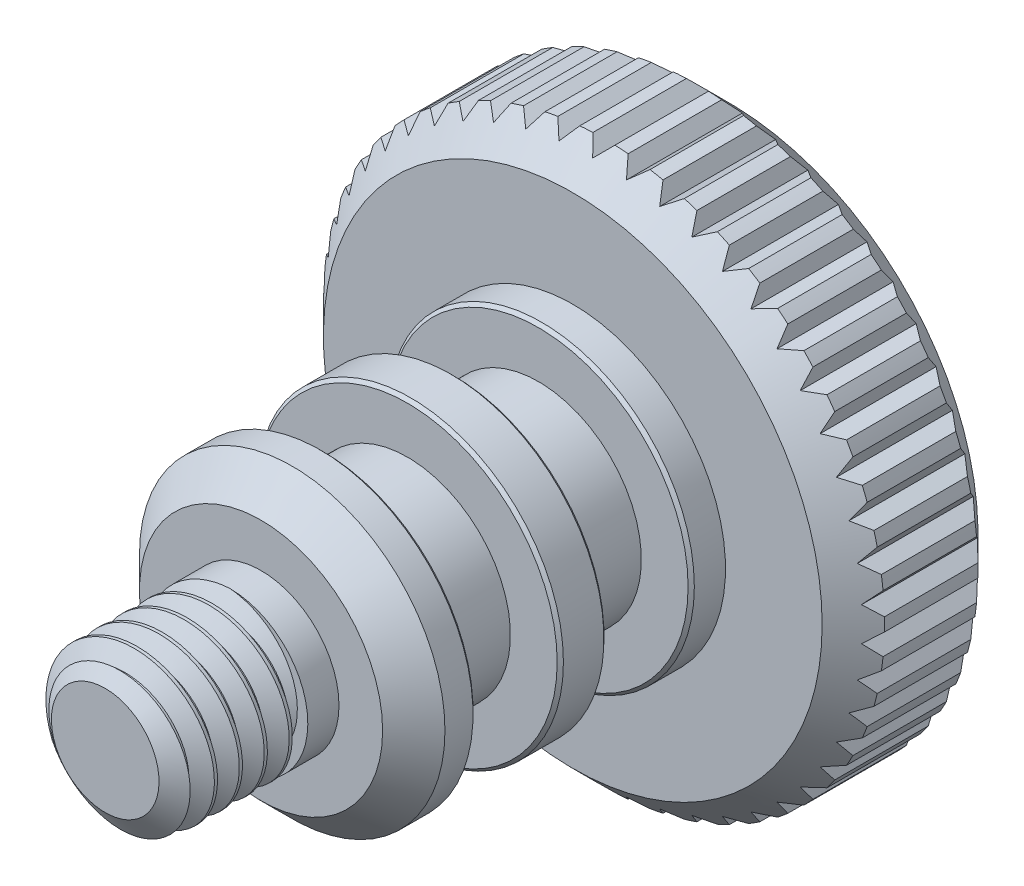
from build123d import *

# Parameters (mm, degrees)
CHAMFER1_SIZE       = 1
CHAMFER2_SIZE       = 0.1
CUT_EXTRUDE1_DEPTH  = 20.672315573
CIRPATTERN1_COUNT   = 50
SKETCH3_R           = 2.5
BOSS_EXTRUDE1_DEPTH = 5
CUT_SWEEP1_PITCH    = 0.8
SKETCH7_R           = 2.5
BOSS_EXTRUDE2_DEPTH = 1


with BuildPart() as part:
    # Sketch1 → Revolve1 (revolve)
    with BuildSketch(Plane(origin=(0, 0, 0), x_dir=(0, 0, -1), z_dir=(1, 0, 0)), mode=Mode.PRIVATE) as revolve1_sk:
        Polygon((0, 0), (0, 4.9), (2, 4.9), (2, 3.3), (4.7, 3.3), (4.7, 4.9), (6.2, 4.9), (6.2, 3.3), (8.9, 3.3), (8.9, 4.9), (10, 4.9), (10, 9), (15, 9), (15, 0), align=None)
    revolve(revolve1_sk.sketch.rotate(Axis((0, 0, -15), (0, 0, 1)), 90), axis=Axis((0, 0, -15), (0, 0, 1)))

    # Chamfer1
    chamfer1_edges = [part.edges().sort_by_distance(p)[0] for p in [
        (9, 0, -10),
        (4.9, 0, 0),
        (9, 0, -15),
    ]]
    chamfer(chamfer1_edges, length=CHAMFER1_SIZE)

    # Chamfer2
    chamfer2_edges = [part.edges().sort_by_distance(p)[0] for p in [
        (4.9, 0, -8.9),
        (4.9, 0, -6.2),
        (4.9, 0, -4.7),
        (4.9, 0, -2),
    ]]
    chamfer(chamfer2_edges, length=CHAMFER2_SIZE)

    # Sketch2 → Cut-Extrude1 (cut, through all)
    with BuildSketch(Plane(origin=(0, 0, -15), x_dir=(-1, 0, 0), z_dir=(0, 0, -1))):
        Polygon((0, 8.639499484), (-0.353553391, 8.993052874), (0, 9.346606265), (0.353553391, 8.993052874), align=None)
    cut_extrude1 = extrude(amount=-CUT_EXTRUDE1_DEPTH, mode=Mode.SUBTRACT)

    # CirPattern1: Cut-Extrude1 ×50 about axis
    cirpattern1_axis = Axis((0, 0, 0), (0, 0, 1))
    for i in range(1, CIRPATTERN1_COUNT):
        add(cut_extrude1.rotate(cirpattern1_axis, i * 360 / CIRPATTERN1_COUNT), mode=Mode.SUBTRACT)

    # Sketch3 → Boss-Extrude1 (add)
    with BuildSketch(Plane.XY):
        Circle(SKETCH3_R)
    extrude(amount=BOSS_EXTRUDE1_DEPTH)

    # Cut-Sweep1: the profile of Sketch4 profile screwed along a right-hand helix of 5.875 turns, 8 arcs to a turn; built about Z, then put on its axis
    cut_sweep1_z = Axis((0, 0, 0), (0, 0, 1))
    cut_sweep1_corners = [(2.5003, 0, 0.000173205), (1.980384758, 0, -0.3), (1.980384758, 0, -0.4), (2.5003, 0, -0.700173205)]
    with BuildLine(mode=Mode.PRIVATE) as cut_sweep1_profile:
        Line(cut_sweep1_corners[0], cut_sweep1_corners[1])
        Line(cut_sweep1_corners[1], cut_sweep1_corners[2])
        Line(cut_sweep1_corners[2], cut_sweep1_corners[3])
        Line(cut_sweep1_corners[3], cut_sweep1_corners[0])
    cut_sweep1_cap = Face(cut_sweep1_profile.wire())
    cut_sweep1_turn_angles = [0, 22.5, 45, 67.5, 90, 112.5, 135, 157.5, 180, 202.5, 225, 247.5, 270, 292.5, 315, 337.5, 360]
    cut_sweep1_turn_weights = [1, 0.9238795325112867, 1, 0.9238795325112867, 1, 0.9238795325112867, 1, 0.9238795325112867, 1, 0.9238795325112867, 1, 0.9238795325112867, 1, 0.9238795325112867, 1, 0.9238795325112867, 1]
    cut_sweep1_turn_rails = [Edge.make_bspline([Vector(p[0], p[1], 0).rotate(cut_sweep1_z, cut_sweep1_turn_angles[k]) / cut_sweep1_turn_weights[k] + Vector(0, 0, p[2] + CUT_SWEEP1_PITCH * cut_sweep1_turn_angles[k] / 360) for k in range(17)], [0, 0, 0, 1, 1, 2, 2, 3, 3, 4, 4, 5, 5, 6, 6, 7, 7, 8, 8, 8], 2, cut_sweep1_turn_weights) for p in cut_sweep1_corners]
    cut_sweep1_turn_sides = [Face.make_surface_from_curves(cut_sweep1_turn_rails[p[0]], cut_sweep1_turn_rails[p[1]]) for p in [(0, 1), (1, 2), (2, 3), (3, 0)]]
    cut_sweep1_last_angles = [1800, 1822.5, 1845, 1867.5, 1890, 1912.5, 1935, 1957.5, 1980, 2002.5, 2025, 2047.5, 2070, 2092.5, 2115]
    cut_sweep1_last_weights = [1, 0.9238795325112867, 1, 0.9238795325112867, 1, 0.9238795325112867, 1, 0.9238795325112867, 1, 0.9238795325112867, 1, 0.9238795325112867, 1, 0.9238795325112655, 1]
    cut_sweep1_last_rails = [Edge.make_bspline([Vector(p[0], p[1], 0).rotate(cut_sweep1_z, cut_sweep1_last_angles[k]) / cut_sweep1_last_weights[k] + Vector(0, 0, p[2] + CUT_SWEEP1_PITCH * cut_sweep1_last_angles[k] / 360) for k in range(15)], [0, 0, 0, 1, 1, 2, 2, 3, 3, 4, 4, 5, 5, 6, 6, 7, 7, 7], 2, cut_sweep1_last_weights) for p in cut_sweep1_corners]
    cut_sweep1_last_sides = [Face.make_surface_from_curves(cut_sweep1_last_rails[p[0]], cut_sweep1_last_rails[p[1]]) for p in [(0, 1), (1, 2), (2, 3), (3, 0)]]
    cut_sweep1 = Plane(origin=(0, 0, 5), x_dir=(0, 1, 0), z_dir=(0, 0, -1)) * Solid(Shell([*[p.moved(Location((0, 0, CUT_SWEEP1_PITCH * i))) for i in range(5) for p in cut_sweep1_turn_sides], *cut_sweep1_last_sides, cut_sweep1_cap, cut_sweep1_cap.rotate(cut_sweep1_z, 2115).moved(Location((0, 0, CUT_SWEEP1_PITCH * 2115 / 360)))]))
    add(cut_sweep1, mode=Mode.SUBTRACT)

    # Sketch6 → Cut-Revolve1 (revolve, cut)
    with BuildSketch(Plane(origin=(0, 0, 0), x_dir=(0, 0, -1), z_dir=(1, 0, 0)), mode=Mode.PRIVATE) as cut_revolve1_sk:
        Polygon((-5, 1.726384758), (-4.458308776, 2.5), (-5, 2.5), align=None)
    revolve(cut_revolve1_sk.sketch.rotate(Axis((0, 0, 0), (0, 0, 1)), 116.146048775), axis=Axis((0, 0, 0), (0, 0, 1)), mode=Mode.SUBTRACT)

    # Sketch7 → Boss-Extrude2 (add)
    with BuildSketch(Plane.XY):
        with Locations(Location((0, 0, 0), (0, 0, 206.146048775))):
            Circle(SKETCH7_R)
    extrude(amount=BOSS_EXTRUDE2_DEPTH)


solid = part.part
